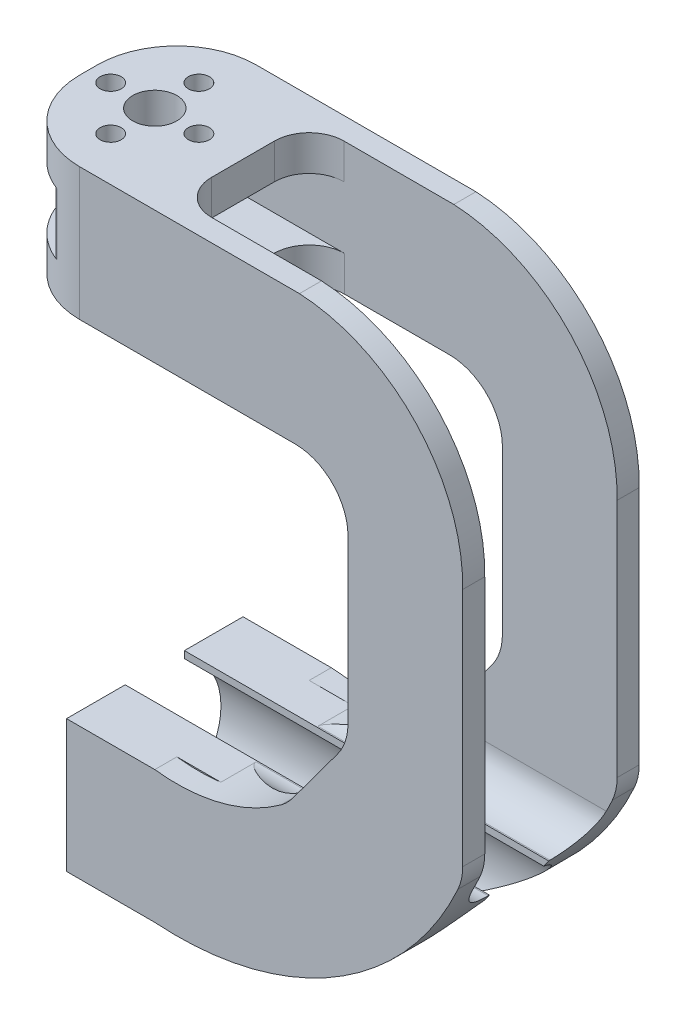
from build123d import *
from build123d.topology import SkipClean

# Parameters (mm, degrees)
BOSS_EXTRUDE1_DEPTH      = 6.35
BOSS_EXTRUDE2_REACH      = 167.379
BOSS_EXTRUDE2_END_RADIUS = 88.9
SKETCH3_R                = 3.2639
CUT_EXTRUDE1_DEPTH       = 12.7
FILLET1_START            = 12.664287544
FILLET1_DEPTH            = 72.850576249
FILLET1_START_2          = 6.35
FILLET1_2_DEPTH          = 11.65
BOSS_EXTRUDE3_START      = 25.4
SKETCH6_R                = 3.2639
BOSS_EXTRUDE3_DEPTH      = 25.4
BOSS_EXTRUDE4_REACH      = 173.13
SKETCH12_W               = 44.467851407
SKETCH12_H               = 10.16
CUT_EXTRUDE4_START       = -38.1
CUT_EXTRUDE4_OUTLINE_R   = 6.35
CUT_EXTRUDE4_OUTLINE_R_2 = 3.03863772
CUT_EXTRUDE4_DEPTH       = 38.1
FILLET2_R                = 10
FILLET3_R                = 22.86
FILLET4_R                = 2.54
FILLET5_R                = 10.16


with BuildPart() as part:
    # Sketch1 → Boss-Extrude1 (new body)
    with BuildSketch(Plane.XY):
        with BuildLine():
            Line((0, 0), (0, -38.1))
            ThreePointArc((0, -38.1), (51.769190694, -25.837088937), (87.265717443, 13.791495212))
            ThreePointArc((87.265717443, 13.791495212), (88.286060361, 16.871201209), (88.631391355, 20.09710189))
            Line((88.631391355, 20.09710189), (88.631391355, 89.207978486))
            ThreePointArc((88.631391355, 89.207978486), (75.290642678, 123.833754792), (41.641030384, 139.474200838))
            Line((41.641030384, 139.474200838), (6.332148593, 139.474200838))
            Line((6.332148593, 139.474200838), (-44.467851407, 139.474200838))
            Line((-44.467851407, 139.474200838), (-44.467851407, 101.374200838))
            Line((-44.467851407, 101.374200838), (22.155707839, 101.374200838))
            Line((22.155707839, 101.374200838), (40.371391355, 101.374200838))
            ThreePointArc((40.371391355, 101.374200838), (51.1476987, 96.910508183), (55.611391355, 86.134200838))
            Line((55.611391355, 86.134200838), (55.611391355, 39.260105227))
            ThreePointArc((55.611391355, 39.260105227), (54.845222321, 34.488751418), (52.623751307, 30.197143481))
            Line((52.623751307, 30.197143481), (39.642030809, 12.646952186))
            ThreePointArc((39.642030809, 12.646952186), (38.13037923, 10.898124826), (36.371619085, 9.398041367))
            ThreePointArc((36.371619085, 9.398041367), (19.083229853, 1.225889591), (0, 0))
        make_face()
    extrude(amount=BOSS_EXTRUDE1_DEPTH)

    # Boss-Extrude2: up to this cylinder (the profile starts inside it)
    boss_extrude2_end = Plane(origin=(6.332148593, 50.574200838, 9.956739), z_dir=(0, 0, -1)) * Cylinder(BOSS_EXTRUDE2_END_RADIUS, 513.558, mode=Mode.PRIVATE)
    # Sketch2 → Boss-Extrude2 (add, up to the surface)
    with BuildSketch(Plane.ZY, mode=Mode.PRIVATE) as boss_extrude2_sk1:
        with BuildLine():
            Line((6.35, 0), (6.35, -19.05))
            ThreePointArc((6.35, -19.05), (9.193771188, -9.036976097), (16.876052251, -2.013427141))
            Line((16.876052251, -2.013427141), (16.876052251, 0))
            Line((16.876052251, 0), (6.35, 0))
        make_face()
    boss_extrude2_tool1 = extrude(boss_extrude2_sk1.sketch, amount=-BOSS_EXTRUDE2_REACH, mode=Mode.PRIVATE) & boss_extrude2_end
    add(boss_extrude2_tool1.solids().sort_by_distance((0, -4.538173, 9.956739))[0])
    # Sketch2 → Boss-Extrude2 (add, up to the surface)
    with BuildSketch(Plane.ZY, mode=Mode.PRIVATE) as boss_extrude2_sk2:
        with BuildLine():
            Line((6.35, -19.05), (6.35, -38.1))
            Line((6.35, -38.1), (16.876052251, -38.1))
            Line((16.876052251, -38.1), (16.876052251, -36.086572859))
            ThreePointArc((16.876052251, -36.086572859), (9.193771188, -29.063023903), (6.35, -19.05))
        make_face()
    boss_extrude2_tool2 = extrude(boss_extrude2_sk2.sketch, amount=-BOSS_EXTRUDE2_REACH, mode=Mode.PRIVATE) & boss_extrude2_end
    add(boss_extrude2_tool2.solids().sort_by_distance((0, -33.561827, 9.956739))[0])

    # Sketch3 → Cut-Extrude1 (cut)
    with BuildSketch(Plane.ZY):
        with Locations(Location((6.35, -31.75, 0), (0, 0, 270))):
            Circle(SKETCH3_R)
        with Locations(Location((6.35, -6.35, 0), (0, 0, 270))):
            Circle(SKETCH3_R)
    extrude(amount=-CUT_EXTRUDE1_DEPTH, mode=Mode.SUBTRACT)

    # Fillet1: read off the stored shape, not the designer's step
    # Fillet1 outline → Fillet1 (add)
    with BuildSketch(Plane.YZ.offset(FILLET1_START)):
        with BuildLine():
            Line((0, 6.35), (10.16, 6.35))
            ThreePointArc((10.16, 6.35), (2.975795103, 9.325795103), (0, 16.51))
            Line((0, 16.51), (0, 6.35))
        make_face()
    extrude(amount=FILLET1_DEPTH)

    # Fillet1 2 outline → Fillet1 2 (cut)
    with SkipClean():  # the faces are left unmerged after this step: merging them gives an invalid solid
        with BuildSketch(Plane.XY.offset(FILLET1_START_2)):
            with BuildLine():
                ThreePointArc((85.514863714, 10.16000004), (82.649094825, 4.978875224), (79.44480283, 0))
                Line((79.44480283, 0), (85.514863793, 0))
                Line((85.514863793, 0), (85.514863714, 10.16000004))
            make_face()
            with BuildLine():
                Line((12.664287544, 10.16), (12.664287693, -1.189e-06))
                ThreePointArc((12.664287693, -1.189e-06), (25.11523399, 3.192330896), (36.371619085, 9.398041367))
                ThreePointArc((36.371619085, 9.398041367), (36.859656603, 9.769354063), (37.332361045, 10.16))
                Line((37.332361045, 10.16), (12.664287544, 10.16))
            make_face()
        extrude(amount=FILLET1_2_DEPTH, mode=Mode.SUBTRACT)

    # Sketch6 → Boss-Extrude3 (add)
    with SkipClean():  # the faces are left unmerged after this step: merging them gives an invalid solid
        with BuildSketch(Plane.ZY.offset(BOSS_EXTRUDE3_START)):
            with BuildLine():
                Line((6.35, 0), (0, 0))
                Line((0, 0), (0, -38.1))
                Line((0, -38.1), (6.35, -38.1))
                Line((6.35, -38.1), (16.876052251, -38.1))
                Line((16.876052251, -38.1), (16.876052251, -36.086572859))
                ThreePointArc((16.876052251, -36.086572859), (6.35, -19.05), (16.876052251, -2.013427141))
                Line((16.876052251, -2.013427141), (16.876052251, 0))
                Line((16.876052251, 0), (6.35, 0))
            make_face()
            with Locations(Location((6.35, -6.35, 0), (0, 0, 270))):
                Circle(SKETCH6_R, mode=Mode.SUBTRACT)
            with Locations(Location((6.35, -31.75, 0), (0, 0, 270))):
                Circle(SKETCH6_R, mode=Mode.SUBTRACT)
        extrude(amount=-BOSS_EXTRUDE3_DEPTH)


with BuildPart() as body_2:
    # Mirror2: mirrored copy
    add(part.part.mirror(Plane.XY.offset(25.4)))

    # Sketch12 → Boss-Extrude4 (add, up to next)
    with BuildSketch(Plane.XY.offset(6.35), mode=Mode.PRIVATE) as boss_extrude4_sk1:
        with Locations((-22.233925704, 134.394200838)):
            Rectangle(SKETCH12_W, SKETCH12_H)
    boss_extrude4_tool1 = extrude(boss_extrude4_sk1.sketch, amount=BOSS_EXTRUDE4_REACH, mode=Mode.PRIVATE) - body_2.part
    # Sketch12 → Boss-Extrude4 (add, up to next)
    with BuildSketch(Plane.XY.offset(6.35), mode=Mode.PRIVATE) as boss_extrude4_sk2:
        with Locations((-22.233925704, 106.454200838)):
            Rectangle(SKETCH12_W, SKETCH12_H)
    boss_extrude4_tool2 = extrude(boss_extrude4_sk2.sketch, amount=BOSS_EXTRUDE4_REACH, mode=Mode.PRIVATE) - body_2.part

    add(part.part)  # Boss-Extrude4 merges part
    add(boss_extrude4_tool1.solids().sort_by_distance((-22.233926, 134.394201, 6.35))[0])
    add(boss_extrude4_tool2.solids().sort_by_distance((-22.233926, 106.454201, 6.35))[0])

    # Cut-Extrude4: read off the stored shape, not the designer's step
    # Cut-Extrude4 outline → Cut-Extrude4 (cut)
    with SkipClean():  # the faces are left unmerged after this step: merging them gives an invalid solid
        with BuildSketch(Plane(origin=(0, 139.474200838, 0), x_dir=(1, 0, 0), z_dir=(0, 1, 0)).offset(CUT_EXTRUDE4_START)):
            with Locations((-25.4, -25.4)):
                Circle(CUT_EXTRUDE4_OUTLINE_R)
            with Locations((-25.4, -38.1)):
                Circle(CUT_EXTRUDE4_OUTLINE_R_2)
            with Locations((-12.7, -25.4)):
                Circle(CUT_EXTRUDE4_OUTLINE_R_2)
            with Locations((-25.4, -12.7)):
                Circle(CUT_EXTRUDE4_OUTLINE_R_2)
            with Locations((-38.1, -25.4)):
                Circle(CUT_EXTRUDE4_OUTLINE_R_2)
        extrude(amount=CUT_EXTRUDE4_DEPTH, mode=Mode.SUBTRACT)

    # Fillet2
    fillet2_edges = [body_2.edges().sort_by_distance(p)[0] for p in [
        (0, 134.394200838, 44.45),
        (0, 134.394200838, 6.35),
    ]]
    fillet(fillet2_edges, radius=FILLET2_R)

    # Fillet3
    # the kernel refuses this fillet: 22.86 mm, written as the material it takes off along each edge
    with BuildSketch(Plane(origin=(-44.467851407, 196.624200838, 50.8), x_dir=(0, 0, -1), z_dir=(0, -1, 0))) as fillet3_piece_1:
        with BuildLine():
            CenterArc((FILLET3_R, FILLET3_R), FILLET3_R, 180, 90)
            Line((0, FILLET3_R), (0, 0))
            Line((0, 0), (FILLET3_R, 0))
        make_face()
    extrude(amount=152.4, mode=Mode.SUBTRACT)
    with BuildSketch(Plane(origin=(-44.467851407, 196.624200838, 0), x_dir=(0, 0, 1), z_dir=(0, -1, 0))) as fillet3_piece_2:
        with BuildLine():
            CenterArc((FILLET3_R, -FILLET3_R), FILLET3_R, 90, 90)
            Line((0, -FILLET3_R), (0, 0))
            Line((0, 0), (FILLET3_R, 0))
        make_face()
    extrude(amount=152.4, mode=Mode.SUBTRACT)

    # Fillet4
    fillet4_edges = [body_2.edges().sort_by_distance(p)[0] for p in [
        (-37.419223896, 120.424200838, 44.45),
        (-37.419223896, 120.424200838, 6.35),
    ]]
    fillet(fillet4_edges, radius=FILLET4_R)

    # Fillet5
    fillet5_edges = [body_2.edges().sort_by_distance(p)[0] for p in [
        (0, 106.454200838, 44.45),
        (0, 106.454200838, 6.35),
    ]]
    fillet(fillet5_edges, radius=FILLET5_R)


solid = body_2.part
